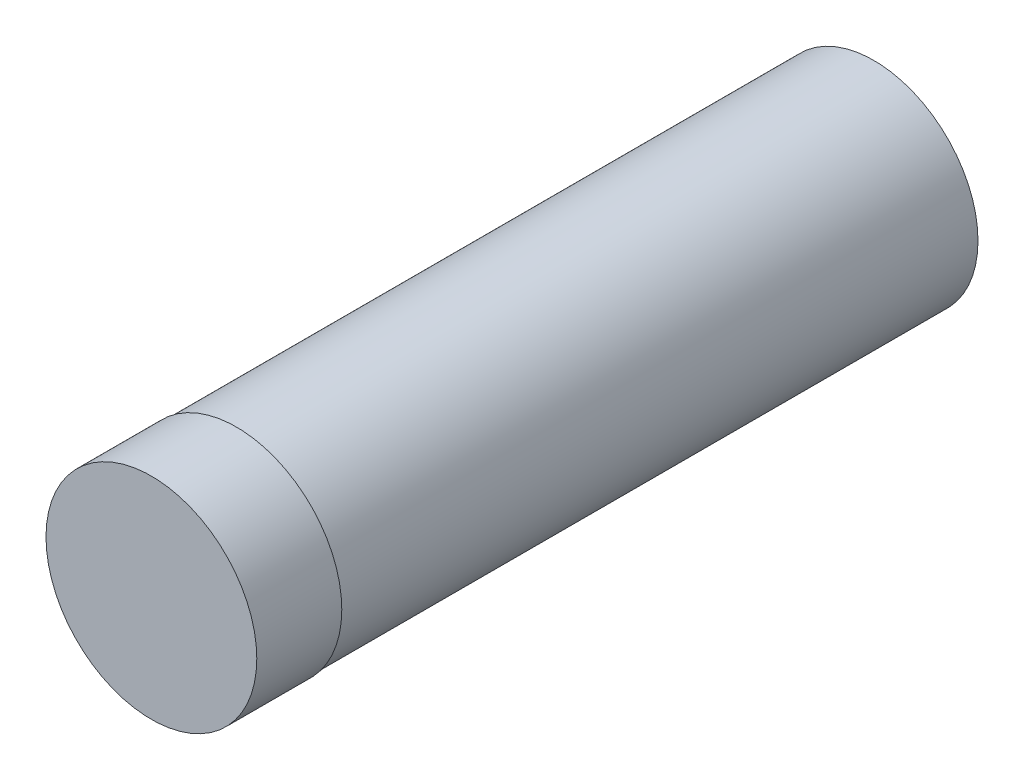
from build123d import *

# Parameters (mm, degrees)
SKETCH1_R           = 2.45
BOSS_EXTRUDE1_DEPTH = 8.5
SKETCH3_R           = 2.48
BOSS_EXTRUDE2_DEPTH = 2


with BuildPart() as part:
    # Sketch1 → Boss-Extrude1 (new, symmetric)
    with BuildSketch(Plane.XY):
        Circle(SKETCH1_R)
    extrude(amount=BOSS_EXTRUDE1_DEPTH, both=True)

    # Sketch3 → Boss-Extrude2 (add)
    with BuildSketch(Plane.XY.offset(8.5)):
        Circle(SKETCH3_R)
    extrude(amount=-BOSS_EXTRUDE2_DEPTH)


solid = part.part
